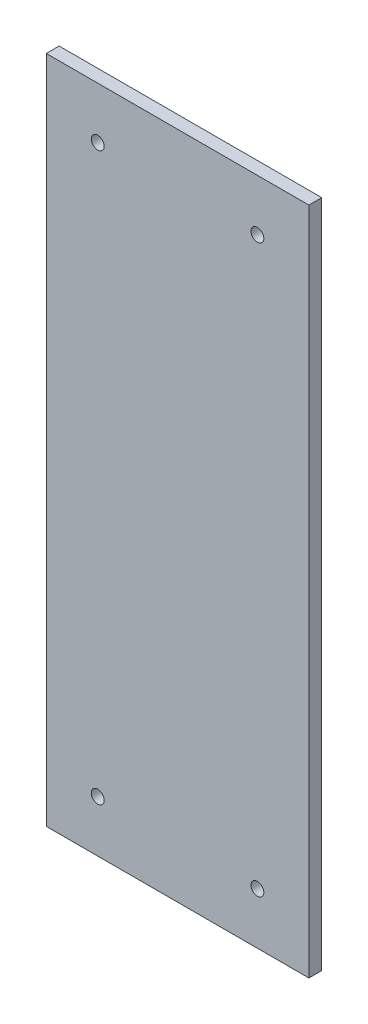
from build123d import *

# Parameters (mm, degrees)
SKETCH1_W            = 129.54
SKETCH1_H            = 330.2
BOSS_EXTRUDE1_DEPTH  = 6.35
SKETCH2_R            = 3.175
CUT_EXTRUDE1_DEPTH   = 6.35
LPATTERN1_COUNT      = 2
LPATTERN1_PITCH      = 78.74
LPATTERN1_COUNT_DIR2 = 2
LPATTERN1_PITCH_DIR2 = 279.4


with BuildPart() as part:
    # Sketch1 → Boss-Extrude1 (new body)
    with BuildSketch(Plane.XY):
        with Locations((64.77, 165.1)):
            Rectangle(SKETCH1_W, SKETCH1_H)
    extrude(amount=BOSS_EXTRUDE1_DEPTH)

    # Sketch2 → Cut-Extrude1 (cut)
    with BuildSketch(Plane.XY.offset(6.35)):
        with Locations((25.4, 304.8)):
            Circle(SKETCH2_R)
    cut_extrude1 = extrude(amount=-CUT_EXTRUDE1_DEPTH, mode=Mode.SUBTRACT)

    # LPattern1: Cut-Extrude1 2 × 2
    with Locations(*[(i * LPATTERN1_PITCH, -j * LPATTERN1_PITCH_DIR2, 0) for i in range(LPATTERN1_COUNT) for j in range(LPATTERN1_COUNT_DIR2) if (i, j) != (0, 0)]):
        add(cut_extrude1, mode=Mode.SUBTRACT)


solid = part.part
